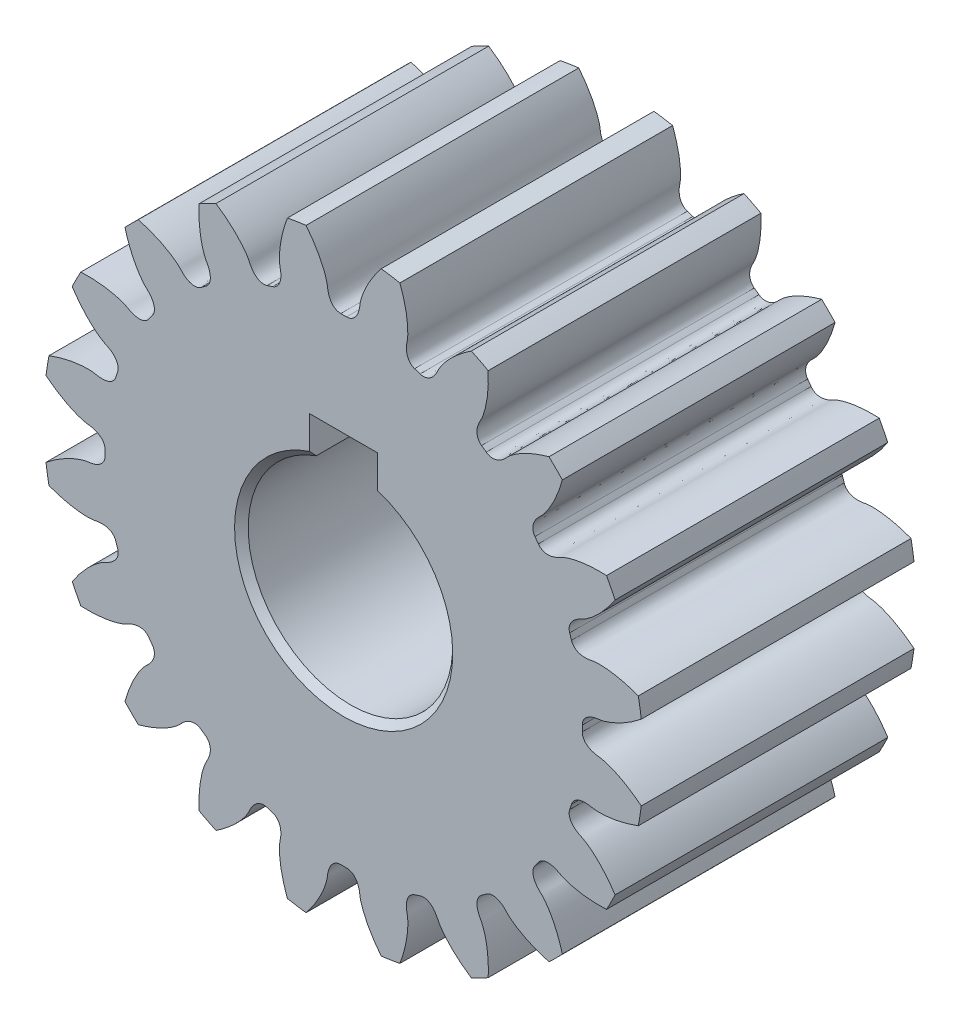
from build123d import *

# Parameters (mm, degrees)
GEAR_BASESKETCH_R                            = 22
F_2_0_40_0000MM_P_D_DEPTH                    = 10
TOOTH_CUT_START                              = -10
TOOTH_CUT_COARSE_PITCH_INVOLUTE_20_DEG_DEPTH = 20
PATTERN_CIRCULAR_1_COUNT                     = 20
SKETCH_3_R                                   = 7.5
CUT_EXTRUDE_2_DEPTH                          = 100
SKETCH_5_R                                   = 13
CUT_EXTRUDE_4_DEPTH                          = 5
SKETCH_6_W                                   = 5
SKETCH_6_H                                   = 5.461126933
CUT_EXTRUDE_5_DEPTH                          = 35.319456494
CHAMFER_1_SIZE                               = 0.5


# Read off the part's stored shape, not the designer's step: Tooth-Cut, Coarse Pitch Involute 20 deg
with BuildPart() as part:
    # Gear-BaseSketch → 2.0 模数    , 40.0000mm P.D. (new, symmetric)
    with BuildSketch(Plane.XY):
        Circle(GEAR_BASESKETCH_R)
    extrude(amount=F_2_0_40_0000MM_P_D_DEPTH, both=True)

    # Tooth-Cut_ Coarse Pitch Involute 20  2 → Tooth-Cut, Coarse Pitch Involute 20 deg (cut)
    with BuildSketch(Plane.XY.offset(TOOTH_CUT_START)):
        with BuildLine():
            ThreePointArc((2.754534238, 21.826876578), (0, 22), (-2.754534238, 21.826876578))
            add(Edge.make_bspline(
                [(-2.754534238, 21.826876578), (-2.681118964, 21.733948974), (-2.519745888, 21.52766974), (-2.290844743, 21.205868631), (-2.072416913, 20.872400506), (-1.884451817, 20.557451124), (-1.72474493, 20.263115948), (-1.59132034, 19.991093549), (-1.482029846, 19.743011464), (-1.394659147, 19.520343611), (-1.326904055, 19.324425048), (-1.276412453, 19.156440604), (-1.240708192, 19.01743215), (-1.217429517, 18.9082683), (-1.20375501, 18.829710621), (-1.196473213, 18.772335917), (-1.19136315, 18.721901652), (-1.184614126, 18.668469511), (-1.171128896, 18.575463434), (-1.144306611, 18.432993335), (-1.092874828, 18.245877512), (-1.015446338, 18.053582714), (-0.909435748, 17.871370442), (-0.759757601, 17.699668703), (-0.546749693, 17.554808993), (-0.347270009, 17.502065077), (-0.230660354, 17.499220375), (-0.210647843, 17.498732168)],
                knots=[0.020044838, 0.020044838, 0.020044838, 0.020044838, 0.086550718, 0.167132421, 0.24174511, 0.310388784, 0.373063444, 0.429769089, 0.480505719, 0.525273336, 0.564071938, 0.596901526, 0.623762101, 0.644653663, 0.659576214, 0.66852976, 0.677129497, 0.688046074, 0.698774041, 0.729909582, 0.769407858, 0.807568596, 0.84602641, 0.887295012, 0.934481431, 0.988755724, 1, 1, 1, 1], degree=3))
            ThreePointArc((-0.210647843, 17.498732168), (0, 17.5), (0.210647843, 17.498732168))
            add(Edge.make_bspline(
                [(0.210647843, 17.498732168), (0.230660354, 17.499220375), (0.347270009, 17.502065077), (0.546749693, 17.554808993), (0.759757601, 17.699668703), (0.909435748, 17.871370442), (1.015446338, 18.053582714), (1.092874828, 18.245877512), (1.144306611, 18.432993335), (1.171128896, 18.575463434), (1.184614126, 18.668469511), (1.19136315, 18.721901652), (1.196473213, 18.772335917), (1.20375501, 18.829710621), (1.217429517, 18.9082683), (1.240708192, 19.01743215), (1.276412453, 19.156440604), (1.326904055, 19.324425048), (1.394659147, 19.520343611), (1.482029846, 19.743011464), (1.59132034, 19.991093549), (1.72474493, 20.263115948), (1.884451817, 20.557451124), (2.072416913, 20.872400506), (2.290844743, 21.205868631), (2.519745888, 21.52766974), (2.681118964, 21.733948974), (2.754534238, 21.826876578)],
                knots=[0, 0, 0, 0, 0.011244276, 0.065518569, 0.112704988, 0.15397359, 0.192431404, 0.230592142, 0.270090418, 0.301225959, 0.311953926, 0.322870503, 0.33147024, 0.340423786, 0.355346337, 0.376237899, 0.403098474, 0.435928062, 0.474726664, 0.519494281, 0.570230911, 0.626936556, 0.689611216, 0.75825489, 0.832867579, 0.913449282, 0.979955162, 0.979955162, 0.979955162, 0.979955162], degree=3))
        make_face()
    tooth_cut_coarse_pitch_involute_20_deg = extrude(amount=TOOTH_CUT_COARSE_PITCH_INVOLUTE_20_DEG_DEPTH, mode=Mode.SUBTRACT)

    # 阵列(圆周)1: Tooth-Cut, Coarse Pitch Involute 20 deg ×20 about axis
    pattern_circular_1_axis = Axis((0, 0, -88.99), (0, 0, 1))
    for i in range(1, PATTERN_CIRCULAR_1_COUNT):
        add(tooth_cut_coarse_pitch_involute_20_deg.rotate(pattern_circular_1_axis, i * 360 / PATTERN_CIRCULAR_1_COUNT), mode=Mode.SUBTRACT)

    # 草图3 → 切除-拉伸2 (cut)
    with BuildSketch(Plane.XY.offset(10)):
        Circle(SKETCH_3_R)
    extrude(amount=-CUT_EXTRUDE_2_DEPTH, mode=Mode.SUBTRACT)

    # 草图5 → 切除-拉伸4 (cut)
    with BuildSketch(Plane(origin=(0, 0, -10), x_dir=(-1, 0, 0), z_dir=(0, 0, -1))):
        Circle(SKETCH_5_R)
    extrude(amount=-CUT_EXTRUDE_4_DEPTH, mode=Mode.SUBTRACT)

    # 草图6 → 切除-拉伸5 (cut, through all)
    with BuildSketch(Plane(origin=(0, 0, -5), x_dir=(-1, 0, 0), z_dir=(0, 0, -1))):
        with Locations((0, 7.269436534)):
            Rectangle(SKETCH_6_W, SKETCH_6_H)
    extrude(amount=-CUT_EXTRUDE_5_DEPTH, mode=Mode.SUBTRACT)

    # 倒角1
    chamfer_1_edges = [part.edges().sort_by_distance(p)[0] for p in [
        (13, 0, -10),
        (0, -7.5, -5),
        (0, -7.5, 10),
    ]]
    chamfer(chamfer_1_edges, length=CHAMFER_1_SIZE)


solid = part.part
